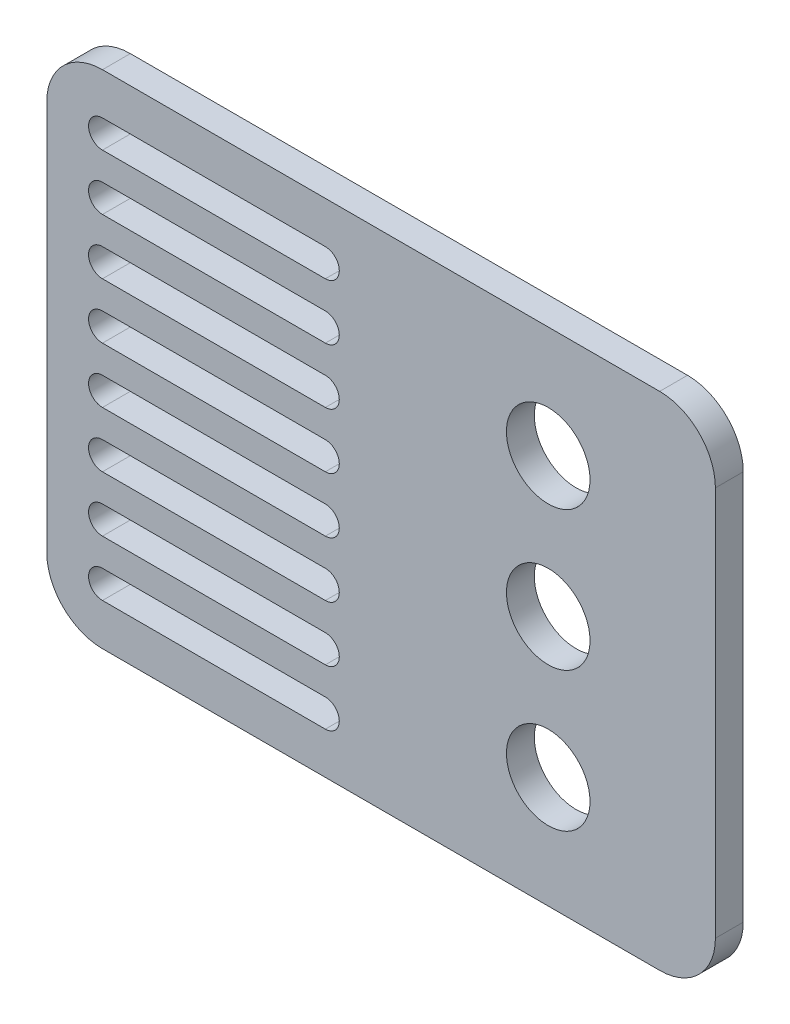
from build123d import *

# Parameters (mm, degrees)
SKETCH1_R           = 9.525
BOSS_EXTRUDE1_DEPTH = 6.35


with BuildPart() as part:
    # Sketch1 → Boss-Extrude1 (new body)
    with BuildSketch(Plane.XY):
        with BuildLine():
            Line((0, 101.6), (0, 12.7))
            ThreePointArc((0, 12.7), (3.719743879, 3.719743879), (12.7, 0))
            Line((12.7, 0), (139.7, 0))
            ThreePointArc((139.7, 0), (148.680256121, 3.719743879), (152.4, 12.7))
            Line((152.4, 12.7), (152.4, 101.6))
            ThreePointArc((152.4, 101.6), (148.680256121, 110.580256121), (139.7, 114.3))
            Line((139.7, 114.3), (12.7, 114.3))
            ThreePointArc((12.7, 114.3), (3.719743879, 110.580256121), (0, 101.6))
        make_face()
        with BuildLine():
            ThreePointArc((12.7, 22.225), (9.525, 25.4), (12.7, 28.575))
            Line((12.7, 28.575), (63.5, 28.575))
            ThreePointArc((63.5, 28.575), (66.675, 25.4), (63.5, 22.225))
            Line((63.5, 22.225), (12.7, 22.225))
        make_face(mode=Mode.SUBTRACT)
        with BuildLine():
            ThreePointArc((12.7, 9.525), (9.525, 12.7), (12.7, 15.875))
            Line((12.7, 15.875), (63.5, 15.875))
            ThreePointArc((63.5, 15.875), (66.675, 12.7), (63.5, 9.525))
            Line((63.5, 9.525), (12.7, 9.525))
        make_face(mode=Mode.SUBTRACT)
        with BuildLine():
            ThreePointArc((12.7, 34.925), (9.525, 38.1), (12.7, 41.275))
            Line((12.7, 41.275), (63.5, 41.275))
            ThreePointArc((63.5, 41.275), (66.675, 38.1), (63.5, 34.925))
            Line((63.5, 34.925), (12.7, 34.925))
        make_face(mode=Mode.SUBTRACT)
        with BuildLine():
            ThreePointArc((12.7, 47.625), (9.525, 50.8), (12.7, 53.975))
            Line((12.7, 53.975), (63.5, 53.975))
            ThreePointArc((63.5, 53.975), (66.675, 50.8), (63.5, 47.625))
            Line((63.5, 47.625), (12.7, 47.625))
        make_face(mode=Mode.SUBTRACT)
        with Locations((114.3, 25.4)):
            Circle(SKETCH1_R, mode=Mode.SUBTRACT)
        with BuildLine():
            ThreePointArc((12.7, 60.325), (9.525, 63.5), (12.7, 66.675))
            Line((12.7, 66.675), (63.5, 66.675))
            ThreePointArc((63.5, 66.675), (66.675, 63.5), (63.5, 60.325))
            Line((63.5, 60.325), (12.7, 60.325))
        make_face(mode=Mode.SUBTRACT)
        with BuildLine():
            ThreePointArc((12.7, 73.025), (9.525, 76.2), (12.7, 79.375))
            Line((12.7, 79.375), (63.5, 79.375))
            ThreePointArc((63.5, 79.375), (66.675, 76.2), (63.5, 73.025))
            Line((63.5, 73.025), (12.7, 73.025))
        make_face(mode=Mode.SUBTRACT)
        with BuildLine():
            ThreePointArc((12.7, 85.725), (9.525, 88.9), (12.7, 92.075))
            Line((12.7, 92.075), (63.5, 92.075))
            ThreePointArc((63.5, 92.075), (66.675, 88.9), (63.5, 85.725))
            Line((63.5, 85.725), (12.7, 85.725))
        make_face(mode=Mode.SUBTRACT)
        with BuildLine():
            ThreePointArc((12.7, 98.425), (9.525, 101.6), (12.7, 104.775))
            Line((12.7, 104.775), (63.5, 104.775))
            ThreePointArc((63.5, 104.775), (66.675, 101.6), (63.5, 98.425))
            Line((63.5, 98.425), (12.7, 98.425))
        make_face(mode=Mode.SUBTRACT)
        with Locations((114.3, 57.15)):
            Circle(SKETCH1_R, mode=Mode.SUBTRACT)
        with Locations((114.3, 88.9)):
            Circle(SKETCH1_R, mode=Mode.SUBTRACT)
    extrude(amount=BOSS_EXTRUDE1_DEPTH)


solid = part.part
